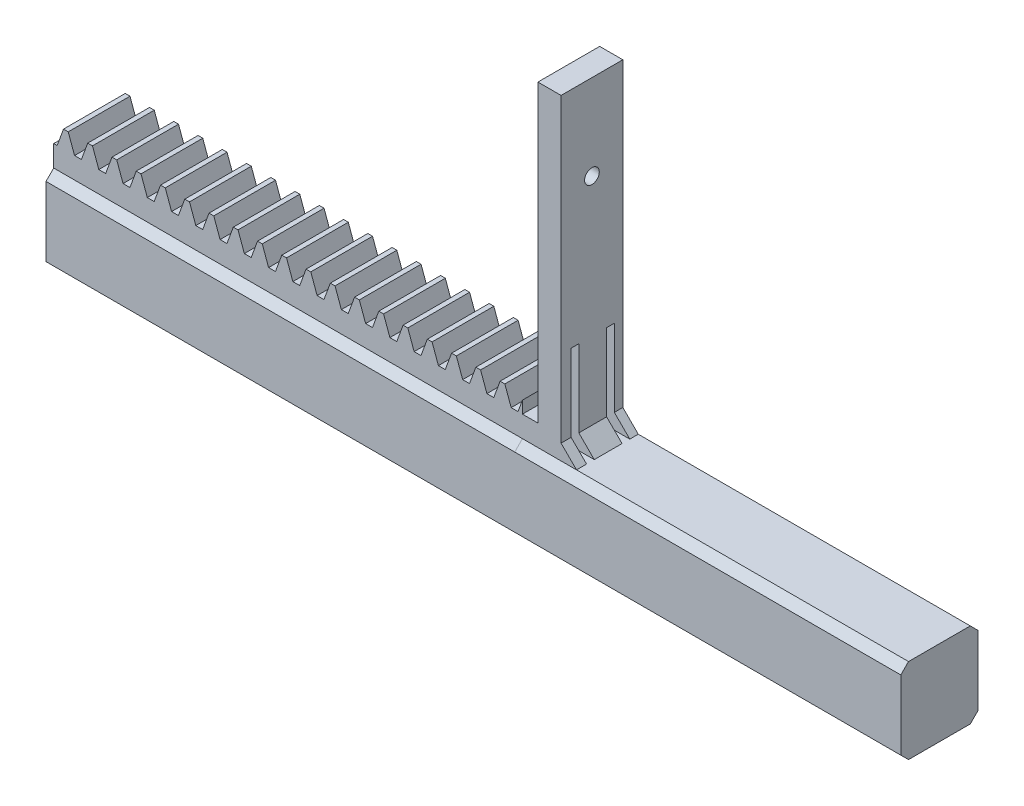
from build123d import *

# Parameters (mm, degrees)
BOSS_EXTRUDE1_DEPTH = 8
SKETCH2_W           = 110.70796325
SKETCH2_H           = 10
BOSS_EXTRUDE2_DEPTH = 10
CHAMFER1_SIZE       = 1
CHAMFER2_SIZE       = 1
SKETCH3_W           = 50
SKETCH3_H           = 8
BOSS_EXTRUDE3_DEPTH = 1
CHAMFER3_SIZE       = 1
CHAMFER4_SIZE       = 1
SKETCH4_W           = 3
SKETCH4_H           = 8
BOSS_EXTRUDE6_DEPTH = 52
SKETCH10_W          = 1
SKETCH10_H          = 12
CUT_EXTRUDE4_DEPTH  = 4
CHAMFER7_SIZE       = 2
SKETCH12_R          = 0.95
CUT_EXTRUDE5_DEPTH  = 4
CHAMFER8_SIZE       = 1
SKETCH13_W          = 2
SKETCH13_H          = 8
BOSS_EXTRUDE7_DEPTH = 2.75


# Some blends are built 0.0001 mm under size
with BuildPart() as part:
    # Sketch1 → Boss-Extrude1 (new body)
    with BuildSketch(Plane(origin=(0, 0, -3.792826984), x_dir=(-1, 0, 0), z_dir=(0, 0, -1))):
        Polygon((23.516961809, -6.40864854), (22.698028781, -8.65864854), (21.809158042, -8.65864854), (21.235890512, -7.083608945), (21.235890512, -12.40864854), (66.235890512, -12.40864854), (81.943853762, -12.40864854), (81.943853762, -8.65864854), (81.499418392, -8.65864854), (80.680485365, -6.40864854), (80.065629509, -6.40864854), (79.246696481, -8.65864854), (78.357825742, -8.65864854), (77.538892715, -6.40864854), (76.924036859, -6.40864854), (76.105103831, -8.65864854), (75.216233092, -8.65864854), (74.397300065, -6.40864854), (73.782444209, -6.40864854), (72.963511181, -8.65864854), (72.074640442, -8.65864854), (71.255707415, -6.40864854), (70.640851559, -6.40864854), (69.821918531, -8.65864854), (68.933047792, -8.65864854), (68.114114765, -6.40864854), (67.499258909, -6.40864854), (66.680325881, -8.65864854), (65.791455142, -8.65864854), (64.972522115, -6.40864854), (64.357666259, -6.40864854), (63.538733231, -8.65864854), (62.649862492, -8.65864854), (61.830929465, -6.40864854), (61.216073609, -6.40864854), (60.397140581, -8.65864854), (59.508269842, -8.65864854), (58.689336815, -6.40864854), (58.074480959, -6.40864854), (57.255547931, -8.65864854), (56.366677192, -8.65864854), (55.547744165, -6.40864854), (54.932888309, -6.40864854), (54.113955281, -8.65864854), (53.225084542, -8.65864854), (52.406151515, -6.40864854), (51.791295659, -6.40864854), (50.972362631, -8.65864854), (50.083491892, -8.65864854), (49.264558865, -6.40864854), (48.649703009, -6.40864854), (47.830769981, -8.65864854), (46.941899242, -8.65864854), (46.122966215, -6.40864854), (45.508110359, -6.40864854), (44.689177331, -8.65864854), (43.800306592, -8.65864854), (42.981373565, -6.40864854), (42.366517709, -6.40864854), (41.547584681, -8.65864854), (40.658713942, -8.65864854), (39.839780915, -6.40864854), (39.224925059, -6.40864854), (38.405992031, -8.65864854), (37.517121292, -8.65864854), (36.698188265, -6.40864854), (36.083332409, -6.40864854), (35.264399381, -8.65864854), (34.375528642, -8.65864854), (33.556595615, -6.40864854), (32.941739759, -6.40864854), (32.122806731, -8.65864854), (31.233935992, -8.65864854), (30.415002965, -6.40864854), (29.800147109, -6.40864854), (28.981214081, -8.65864854), (28.092343342, -8.65864854), (27.273410315, -6.40864854), (26.658554459, -6.40864854), (25.839621431, -8.65864854), (24.950750692, -8.65864854), (24.131817665, -6.40864854), align=None)
    extrude(amount=-BOSS_EXTRUDE1_DEPTH)

    # Sketch2 → Boss-Extrude2 (add)
    with BuildSketch(Plane.XZ.offset(12.40864854)):
        with Locations((-26.589872137, 0.207173016)):
            Rectangle(SKETCH2_W, SKETCH2_H)
    extrude(amount=BOSS_EXTRUDE2_DEPTH)

    # Chamfer1
    chamfer1_edges = [part.edges().sort_by_distance(p)[0] for p in [
        (-51.589872137, -12.40864854, 4.207173016),
    ]]
    chamfer(chamfer1_edges, length=CHAMFER1_SIZE - 0.0001)  # a hair under: the kernel refuses the full size

    # Chamfer2
    chamfer2_edges = [part.edges().sort_by_distance(p)[0] for p in [
        (-51.589872137, -12.40864854, -3.792826984),
    ]]
    chamfer(chamfer2_edges, length=CHAMFER2_SIZE - 0.0001)  # a hair under: the kernel refuses the full size

    # Sketch3 → Boss-Extrude3 (add)
    with BuildSketch(Plane(origin=(0, -12.40864854, 0), x_dir=(1, 0, 0), z_dir=(0, 1, 0))):
        with Locations((3.764109488, -0.207173016)):
            Rectangle(SKETCH3_W, SKETCH3_H)
    extrude(amount=BOSS_EXTRUDE3_DEPTH)

    # Chamfer3
    # the kernel refuses this chamfer: 1 mm, written as the material it adds along each edge
    with BuildSketch(Plane(origin=(28.764109488, -12.40864854, 4.207173016), x_dir=(0, 0, 1), z_dir=(-1, 0, 0))) as chamfer3_piece_1_section:
        Polygon((CHAMFER3_SIZE, 0), (0, CHAMFER3_SIZE), (0, 0), align=None)
    chamfer3_piece_1 = extrude(amount=50, mode=Mode.PRIVATE)
    chamfer3_piece_1 = split(chamfer3_piece_1, bisect_by=Plane(origin=(28.764109488, -12.40864854, 5.207173016), z_dir=(0, 0, -1)), keep=Keep.TOP, mode=Mode.PRIVATE)
    chamfer3_piece_1 = split(chamfer3_piece_1, bisect_by=Plane(origin=(28.764109488, -11.40864854, 4.207173016), z_dir=(0, -1, 0)), keep=Keep.TOP, mode=Mode.PRIVATE)
    add(chamfer3_piece_1)
    with BuildSketch(Plane(origin=(28.764109488, -12.40864854, 4.207173016), x_dir=(0, 0, 1), z_dir=(-1, 0, 0))) as chamfer3_piece_2_section:
        Polygon((CHAMFER3_SIZE, 0), (0, CHAMFER3_SIZE), (0, 0), align=None)
    chamfer3_piece_2 = extrude(amount=52.571682988, mode=Mode.PRIVATE)
    chamfer3_piece_2 = split(chamfer3_piece_2, bisect_by=Plane(origin=(-21.235890512, -12.40864854, 4.207173016), z_dir=(-1, 0, 0)), keep=Keep.TOP, mode=Mode.PRIVATE)
    chamfer3_piece_2 = split(chamfer3_piece_2, bisect_by=Plane(origin=(28.764109488, -12.40864854, 5.207173016), z_dir=(0, 0, -1)), keep=Keep.TOP, mode=Mode.PRIVATE)
    chamfer3_piece_2 = split(chamfer3_piece_2, bisect_by=Plane(origin=(28.764109488, -11.40864854, 4.207173016), z_dir=(0, -1, 0)), keep=Keep.TOP, mode=Mode.PRIVATE)
    add(chamfer3_piece_2)

    # Chamfer4
    chamfer4_edges = [part.edges().sort_by_distance(p)[0] for p in [
        (3.764109488, -12.40864854, -3.792826984),
    ]]
    chamfer(chamfer4_edges, length=CHAMFER4_SIZE - 0.0001)  # a hair under: the kernel refuses the full size

    # Sketch4 → Boss-Extrude6 (add)
    with BuildSketch(Plane.XZ.offset(22.40864854)):
        with Locations((-17.735890512, 0.207173016)):
            Rectangle(SKETCH4_W, SKETCH4_H)
    extrude(amount=-BOSS_EXTRUDE6_DEPTH)

    # Sketch10 → Cut-Extrude4 (cut)
    with BuildSketch(Plane(origin=(-16.235890512, 0, 0), x_dir=(0, 0, -1), z_dir=(1, 0, 0))):
        with Locations((-2.407173016, -5.40864854)):
            Rectangle(SKETCH10_W, SKETCH10_H)
        with Locations((2.192826984, -5.40864854)):
            Rectangle(SKETCH10_W, SKETCH10_H)
    extrude(amount=-CUT_EXTRUDE4_DEPTH, mode=Mode.SUBTRACT)

    # Chamfer7
    chamfer7_edges = [part.edges().sort_by_distance(p)[0] for p in [
        (-16.235890512, -11.40864854, 3.557173016),
        (-16.235890512, -11.40864854, 0.107173016),
        (-16.235890512, -11.40864854, -3.242826984),
    ]]
    chamfer(chamfer7_edges, length=CHAMFER7_SIZE)

    # Sketch12 → Cut-Extrude5 (cut)
    with BuildSketch(Plane.ZY.offset(19.235890512)):
        with Locations((0.207173016, 18.54135146)):
            Circle(SKETCH12_R)
    extrude(amount=-CUT_EXTRUDE5_DEPTH, mode=Mode.SUBTRACT)

    # Chamfer8
    chamfer8_edges = [part.edges().sort_by_distance(p)[0] for p in [
        (-26.589872137, -22.40864854, -4.792826984),
        (-26.589872137, -22.40864854, 5.207173016),
    ]]
    chamfer(chamfer8_edges, length=CHAMFER8_SIZE)

    # Sketch13 → Boss-Extrude7 (add)
    with BuildSketch(Plane(origin=(0, -11.40864854, 0), x_dir=(1, 0, 0), z_dir=(0, 1, 0))):
        with Locations((-20.235890512, -0.207173016)):
            Rectangle(SKETCH13_W, SKETCH13_H)
    extrude(amount=BOSS_EXTRUDE7_DEPTH)


solid = part.part
